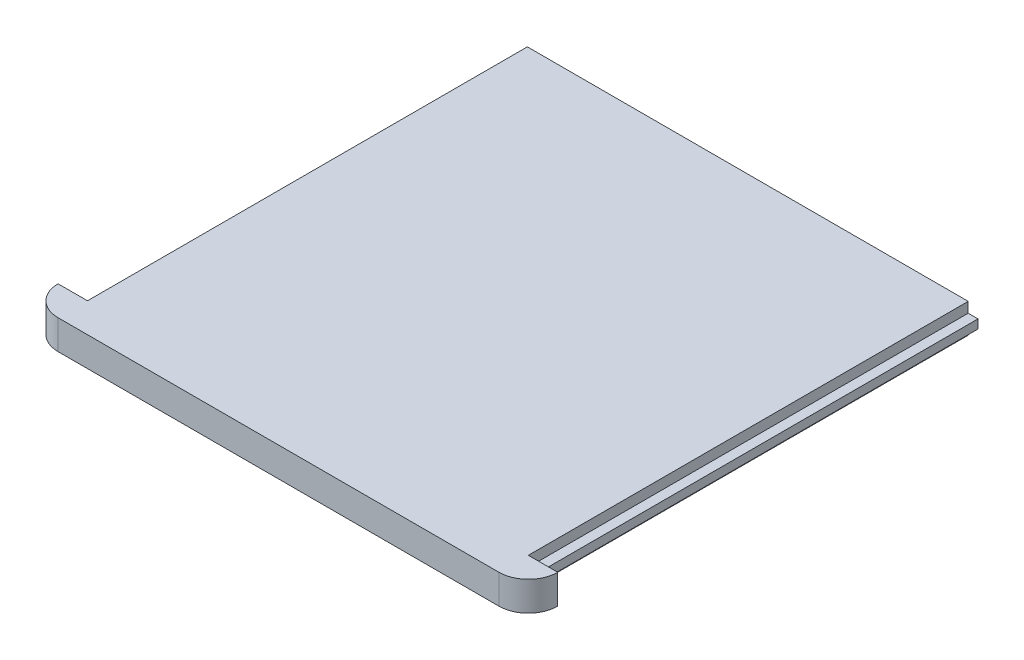
from build123d import *

# Parameters (mm, degrees)
SKETCH1_W           = 45
SKETCH1_H           = 45
BOSS_EXTRUDE1_DEPTH = 3
SKETCH29_W          = 45
SKETCH29_H          = 1
BOSS_EXTRUDE2_DEPTH = 1
SKETCH30_W          = 45
SKETCH30_H          = 1
BOSS_EXTRUDE3_DEPTH = 1
CUT_EXTRUDE2_DEPTH  = 1.5
SKETCH32_W          = 12
SKETCH32_H          = 1.5
BOSS_EXTRUDE4_DEPTH = 8
SKETCH33_W          = 1
SKETCH33_H          = 0.05
CUT_EXTRUDE3_DEPTH  = 86
SKETCH34_W          = 52.951386634
SKETCH34_H          = 17.48442651
CUT_EXTRUDE4_DEPTH  = 0.1
BOSS_EXTRUDE5_DEPTH = 3
FILLET1_R           = 3


with BuildPart() as part:
    # Sketch1 → Boss-Extrude1 (new body)
    with BuildSketch(Plane(origin=(0, 0, 0), x_dir=(1, 0, 0), z_dir=(0, 1, 0))):
        Rectangle(SKETCH1_W, SKETCH1_H)
    extrude(amount=BOSS_EXTRUDE1_DEPTH)

    # Sketch29 → Boss-Extrude2 (add)
    with BuildSketch(Plane(origin=(22.5, 0, 0), x_dir=(0, 0, -1), z_dir=(1, 0, 0))):
        with Locations((0, 1.5)):
            Rectangle(SKETCH29_W, SKETCH29_H)
    extrude(amount=BOSS_EXTRUDE2_DEPTH)

    # Sketch30 → Boss-Extrude3 (add)
    with BuildSketch(Plane.ZY.offset(22.5)):
        with Locations((0, 1.5)):
            Rectangle(SKETCH30_W, SKETCH30_H)
    extrude(amount=BOSS_EXTRUDE3_DEPTH)

    # Sketch31 → Cut-Extrude2 (cut)
    with BuildSketch(Plane(origin=(0, 3, 0), x_dir=(1, 0, 0), z_dir=(0, 1, 0))):
        Polygon((-2, -22.5), (-2, -18.5), (-6, -18.5), (-6, -14.5), (6, -14.5), (6, -18.5), (2, -18.5), (2, -22.5), align=None)
    extrude(amount=-CUT_EXTRUDE2_DEPTH, mode=Mode.SUBTRACT)

    # Sketch32 → Boss-Extrude4 (add)
    with BuildSketch(Plane.XY.offset(14.5)):
        with Locations((0, 2.25)):
            Rectangle(SKETCH32_W, SKETCH32_H)
    extrude(amount=BOSS_EXTRUDE4_DEPTH)

    # Sketch33 → Cut-Extrude3 (cut)
    with BuildSketch(Plane.XY.offset(22.5)):
        with Locations((-23, 1.975)):
            Rectangle(SKETCH33_W, SKETCH33_H)
        with Locations((-23, 1.025)):
            Rectangle(SKETCH33_W, SKETCH33_H)
        with Locations((23, 1.025)):
            Rectangle(SKETCH33_W, SKETCH33_H)
        with Locations((23, 1.975)):
            Rectangle(SKETCH33_W, SKETCH33_H)
    extrude(amount=-CUT_EXTRUDE3_DEPTH, mode=Mode.SUBTRACT)

    # Sketch34 → Cut-Extrude4 (cut)
    with BuildSketch(Plane.XY.offset(22.5)):
        Rectangle(SKETCH34_W, SKETCH34_H)
    extrude(amount=-CUT_EXTRUDE4_DEPTH, mode=Mode.SUBTRACT)

    # Sketch35 → Boss-Extrude5 (add)
    with BuildSketch(Plane.XY.offset(22.4)):
        Polygon((-22.5, 3), (25.5, 3), (25.5, 0), (-25.5, 0), (-25.5, 3), align=None)
    extrude(amount=BOSS_EXTRUDE5_DEPTH)

    # Fillet1
    fillet1_edges = [part.edges().sort_by_distance(p)[0] for p in [
        (25.5, 1.5, 25.4),
        (-25.5, 1.5, 25.4),
    ]]
    fillet(fillet1_edges, radius=FILLET1_R - 0.0001)  # a hair under: the kernel refuses the full size


solid = part.part
